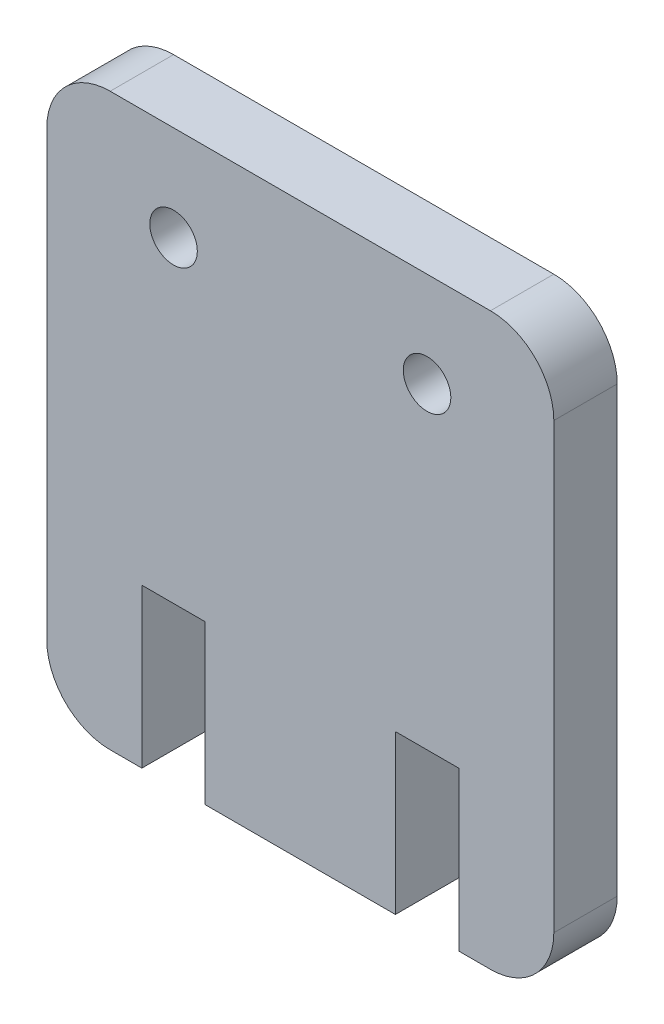
from build123d import *

# Parameters (mm, degrees)
MODEL_R             = 0.75
BOSS_EXTRUDE1_DEPTH = 2


with BuildPart() as part:
    # Model → Boss-Extrude1 (new body)
    with BuildSketch(Plane.XY):
        with BuildLine():
            Line((2, 0), (3, 0))
            Line((3, 0), (3, 5))
            Line((3, 5), (5, 5))
            Line((5, 5), (5, 0))
            Line((5, 0), (11, 0))
            Line((11, 0), (11, 5))
            Line((11, 5), (13, 5))
            Line((13, 5), (13, 0))
            Line((13, 0), (14, 0))
            ThreePointArc((14, 0), (15.414213562, 0.585786438), (16, 2))
            Line((16, 2), (16, 16))
            ThreePointArc((16, 16), (15.414213562, 17.414213562), (14, 18))
            Line((14, 18), (2, 18))
            ThreePointArc((2, 18), (0.585786438, 17.414213562), (0, 16))
            Line((0, 16), (0, 2))
            ThreePointArc((0, 2), (0.585786438, 0.585786438), (2, 0))
        make_face()
        with Locations((4, 15)):
            Circle(MODEL_R, mode=Mode.SUBTRACT)
        with Locations((12, 15)):
            Circle(MODEL_R, mode=Mode.SUBTRACT)
    extrude(amount=BOSS_EXTRUDE1_DEPTH)


solid = part.part
